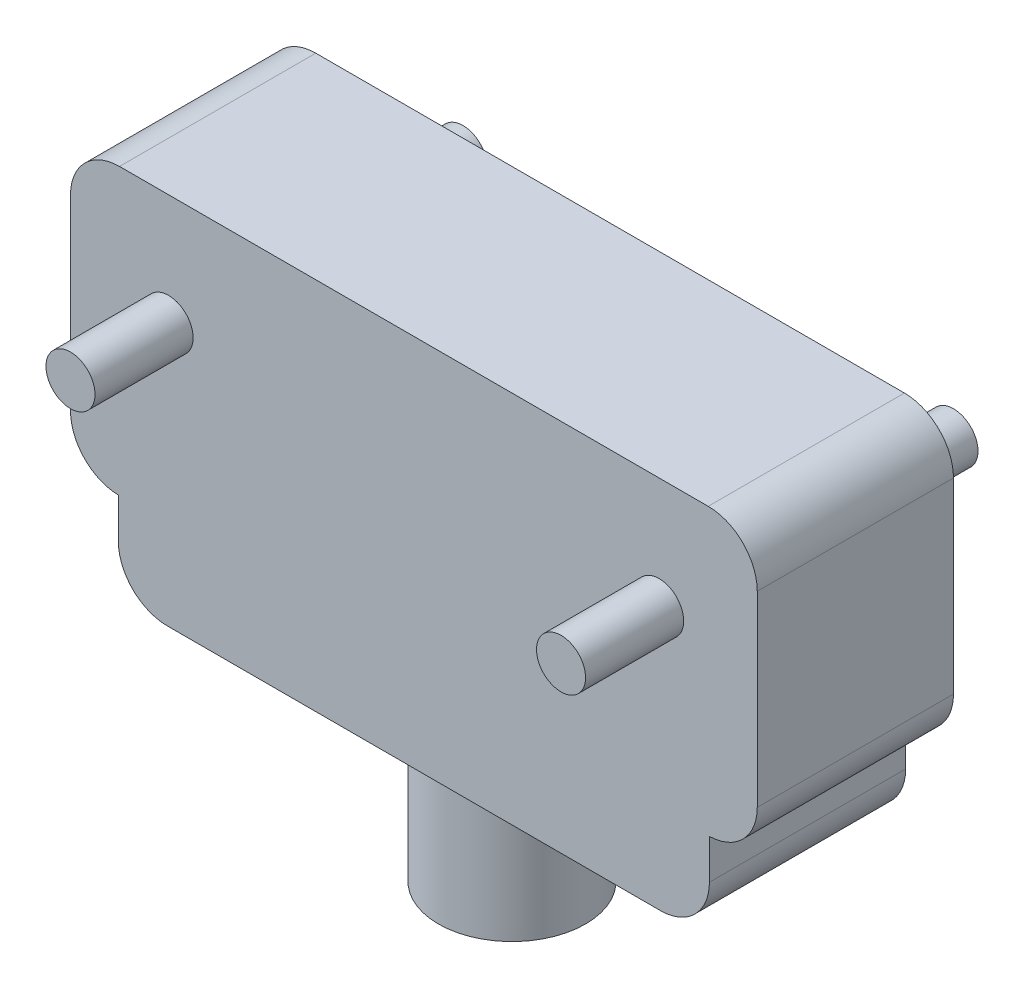
from build123d import *

# Parameters (mm, degrees)
SKETCH1_R             = 2.5
BOSS_EXTRUDE1_DEPTH   = 10
BOSS_EXTRUDE1_2_DEPTH = 10
BOSS_EXTRUDE2_DEPTH   = 20
FILLET1_R             = 5
SKETCH4_R             = 7.5
BOSS_EXTRUDE3_DEPTH   = 15
BOSS_EXTRUDE4_START   = 10
SKETCH5_R             = 2.5
BOSS_EXTRUDE4_DEPTH   = 10


with BuildPart() as part:
    # Sketch1 → Boss-Extrude1 (new body)
    with BuildSketch(Plane.XY):
        with Locations((90.07, -85.065581077)):
            Circle(SKETCH1_R)
    extrude(amount=-BOSS_EXTRUDE1_DEPTH)



with BuildPart() as body_2:
    # Sketch1 → Boss-Extrude1 2 (new body)
    with BuildSketch(Plane.XY):
        with Locations((40.07, -85.065581077)):
            Circle(SKETCH1_R)
    extrude(amount=-BOSS_EXTRUDE1_2_DEPTH)


with BuildPart() as part_1:
    add(part.part)

    add(body_2.part)  # Boss-Extrude2 merges body 2
    # Sketch2 → Boss-Extrude2 (add)
    with BuildSketch(Plane.XY):
        Polygon((30.07, -73.682440954), (100.07, -73.682440954), (100.07, -102.755947539), (95.194338838, -102.755947539), (95.194338838, -111.806017714), (34.945661162, -111.806017714), (34.945661162, -102.755947539), (30.07, -102.755947539), align=None)
    extrude(amount=BOSS_EXTRUDE2_DEPTH)

    # Fillet1
    # the kernel refuses this fillet: 5 mm, written as the material it takes off along each edge
    with BuildSketch(Plane(origin=(100.07, -73.682440954, -12.5), x_dir=(-1, 0, 0), z_dir=(0, 0, 1)), Plane(origin=(95.194338838, -111.806017714, -12.5), x_dir=(0, 1, 0), z_dir=(0, 0, 1))) as fillet1_piece_1:
        with BuildLine():
            CenterArc((FILLET1_R, FILLET1_R), FILLET1_R, 180, 90)
            Line((0, FILLET1_R), (-FILLET1_R * 0.02, FILLET1_R))
            Line((-FILLET1_R * 0.02, FILLET1_R), (-FILLET1_R * 0.02, -FILLET1_R * 0.02))
            Line((-FILLET1_R * 0.02, -FILLET1_R * 0.02), (FILLET1_R, -FILLET1_R * 0.02))
            Line((FILLET1_R, -FILLET1_R * 0.02), (FILLET1_R, 0))
        make_face()
    extrude(amount=45, mode=Mode.SUBTRACT)
    with BuildSketch(Plane(origin=(100.07, -102.755947539, -12.496134366), x_dir=(0, 1, 0), z_dir=(0, 0, 1))) as fillet1_piece_2:
        with BuildLine():
            CenterArc((4.998453746, 5), FILLET1_R, 181.424965019, 88.575034981)
            Line((0, 4.875661162), (-0.099969075, 4.873174386))
            ThreePointArc((-0.099969075, 4.873174386), (-0.1, 2.437830581), (-0.1, 0))
            Line((-0.1, 0), (0, -0.1))
            Line((0, -0.1), (4.998453746, -0.1))
            Line((4.998453746, -0.1), (4.998453746, 0))
        make_face()
    extrude(amount=44.992268731, mode=Mode.SUBTRACT)
    with BuildSketch(Plane(origin=(34.945661162, -111.806017714, -12.5), x_dir=(0, 1, 0), z_dir=(0, 0, 1)), Plane(origin=(30.07, -73.682440954, -12.5), x_dir=(1, 0, 0), z_dir=(0, 0, 1))) as fillet1_piece_3:
        with BuildLine():
            CenterArc((FILLET1_R, -FILLET1_R), FILLET1_R, 90, 90)
            Line((0, -FILLET1_R), (-FILLET1_R * 0.02, -FILLET1_R))
            Line((-FILLET1_R * 0.02, -FILLET1_R), (-FILLET1_R * 0.02, FILLET1_R * 0.02))
            Line((-FILLET1_R * 0.02, FILLET1_R * 0.02), (FILLET1_R, FILLET1_R * 0.02))
            Line((FILLET1_R, FILLET1_R * 0.02), (FILLET1_R, 0))
        make_face()
    extrude(amount=45, mode=Mode.SUBTRACT)
    with BuildSketch(Plane(origin=(30.07, -102.755947539, -12.496134366), x_dir=(0, 1, 0), z_dir=(0, 0, 1))) as fillet1_piece_4:
        with BuildLine():
            CenterArc((4.998453746, -5), FILLET1_R, 90, 88.575034981)
            Line((0, -4.875661162), (-0.099969075, -4.873174386))
            ThreePointArc((-0.099969075, -4.873174386), (-0.1, -2.437830581), (-0.1, 0))
            Line((-0.1, 0), (0, 0.1))
            Line((0, 0.1), (4.998453746, 0.1))
            Line((4.998453746, 0.1), (4.998453746, 0))
        make_face()
    extrude(amount=44.992268731, mode=Mode.SUBTRACT)

    # Sketch4 → Boss-Extrude3 (add)
    with BuildSketch(Plane.XZ.offset(111.806017714)):
        with Locations(Location((65.07, 10, 0), (0, 0, 90))):
            Circle(SKETCH4_R)
    extrude(amount=BOSS_EXTRUDE3_DEPTH)

    # Sketch5 → Boss-Extrude4 (add)
    with BuildSketch(Plane.XY.offset(20).offset(BOSS_EXTRUDE4_START)):
        with Locations((90.07, -85.065581077)):
            Circle(SKETCH5_R)
        with Locations((40.07, -85.065581077)):
            Circle(SKETCH5_R)
    extrude(amount=-BOSS_EXTRUDE4_DEPTH)


solid = part_1.part
